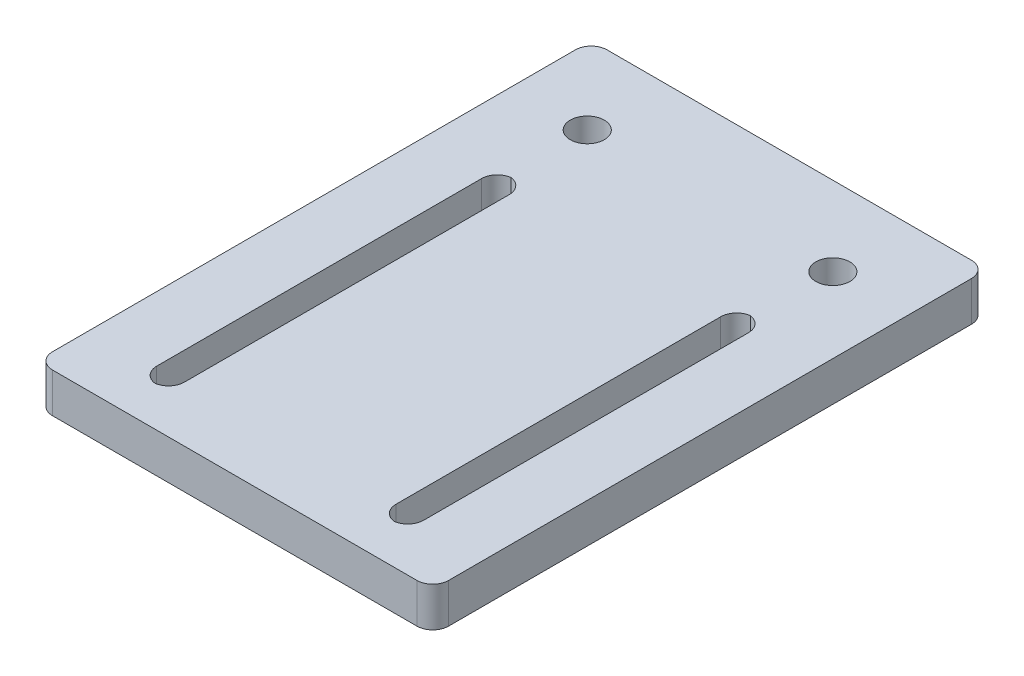
from build123d import *

# Parameters (mm, degrees)
SKETCH_1_W      = 50
SKETCH_1_H      = 70
SKETCH_1_R      = 2.15
SKETCH_1_W_2    = 3.5
SKETCH_1_H_2    = 45
EXTRUDE_1_DEPTH = 5
FILLET_1_R      = 2
FILLET_2_R      = 2


with BuildPart() as part:
    # 草圖1 → 填料-伸長1 (new body)
    with BuildSketch(Plane(origin=(0, 0, 0), x_dir=(1, 0, 0), z_dir=(0, 1, 0))):
        Rectangle(SKETCH_1_W, SKETCH_1_H)
        with Locations(Location((-15.5, 25, 0), (0, 0, 270))):
            Circle(SKETCH_1_R, mode=Mode.SUBTRACT)
        with Locations(Location((15.5, 25, 0), (0, 0, 270))):
            Circle(SKETCH_1_R, mode=Mode.SUBTRACT)
        with Locations((-15.1, -7.5)):
            Rectangle(SKETCH_1_W_2, SKETCH_1_H_2, mode=Mode.SUBTRACT)
        with Locations((15.1, -7.5)):
            Rectangle(SKETCH_1_W_2, SKETCH_1_H_2, mode=Mode.SUBTRACT)
    extrude(amount=EXTRUDE_1_DEPTH)

    # 圓角1
    # the kernel refuses this fillet: 2 mm, written as the material it adds along each edge
    with BuildSketch(Plane(origin=(16.85, 0, 30), x_dir=(0, 0, -1), z_dir=(0, 1, 0)), Plane(origin=(-13.35, 0, 30), x_dir=(0, 0, -1), z_dir=(0, 1, 0))) as fillet_1_piece_1:
        with BuildLine():
            CenterArc((FILLET_1_R, FILLET_1_R), FILLET_1_R, 180, 90)
            Line((0, FILLET_1_R), (0, 0))
            Line((0, 0), (FILLET_1_R, 0))
        make_face()
    extrude(amount=5)
    with BuildSketch(Plane(origin=(13.35, 0, 30), x_dir=(0, 0, -1), z_dir=(0, 1, 0)), Plane(origin=(-16.85, 0, 30), x_dir=(0, 0, -1), z_dir=(0, 1, 0)), Plane(origin=(16.85, 0, -15), x_dir=(0, 0, 1), z_dir=(0, 1, 0)), Plane(origin=(13.35, 0, -15), x_dir=(1, 0, 0), z_dir=(0, 1, 0)), Plane(origin=(-13.35, 0, -15), x_dir=(0, 0, 1), z_dir=(0, 1, 0)), Plane(origin=(-16.85, 0, -15), x_dir=(1, 0, 0), z_dir=(0, 1, 0))) as fillet_1_piece_2:
        with BuildLine():
            CenterArc((FILLET_1_R, -FILLET_1_R), FILLET_1_R, 90, 90)
            Line((0, -FILLET_1_R), (0, 0))
            Line((0, 0), (FILLET_1_R, 0))
        make_face()
    extrude(amount=5)

    # 圓角2
    fillet_2_edges = [part.edges().sort_by_distance(p)[0] for p in [
        (25, 2.5, 35),
        (-25, 2.5, 35),
        (-25, 2.5, -35),
        (25, 2.5, -35),
    ]]
    fillet(fillet_2_edges, radius=FILLET_2_R)


solid = part.part
